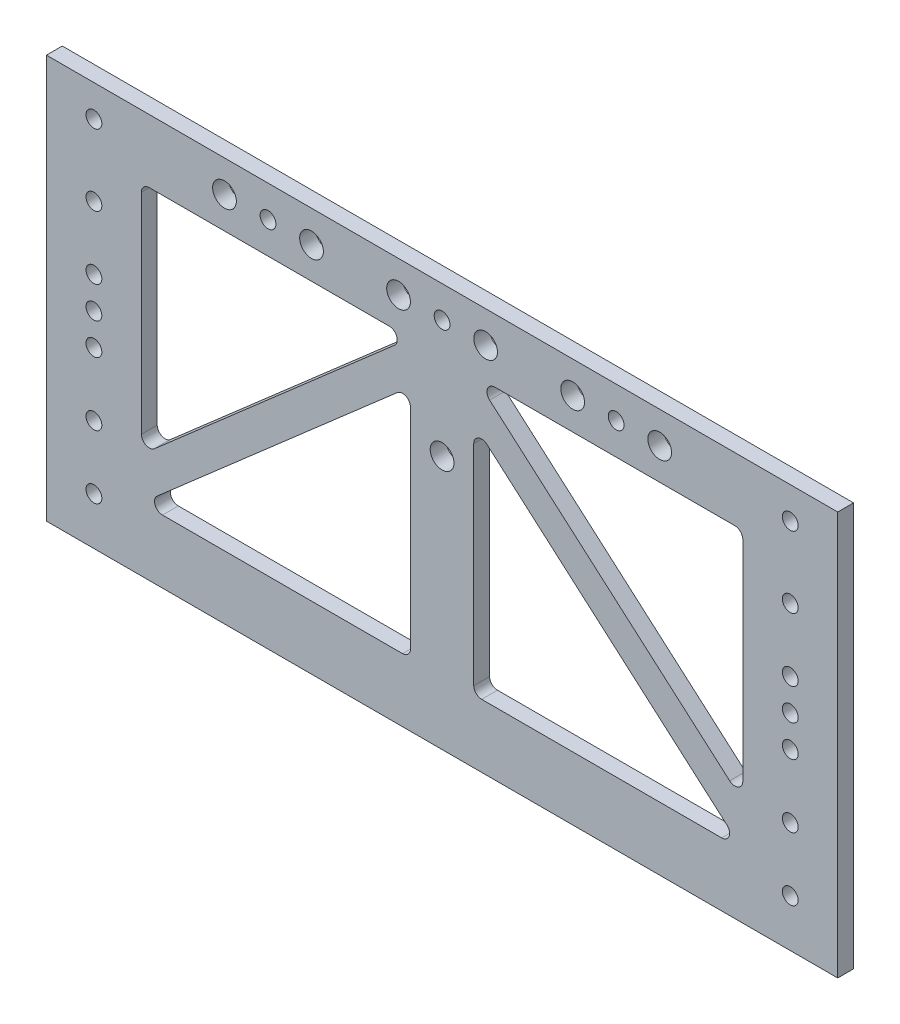
from build123d import *

# Parameters (mm, degrees)
SKETCH1_W                   = 635
SKETCH1_H                   = 323.85
BOSS_EXTRUDE1_DEPTH         = 12.7
F_3_4_0_75_DIAMETER_HOLE1_D = 19.05
F_1_2_0_5_DIAMETER_HOLE1_D  = 12.7
LPATTERN1_COUNT             = 2
LPATTERN1_PITCH             = 558.8
LPATTERN1_COUNT_DIR2        = 5
LPATTERN1_PITCH_DIR2        = 50.8
HOLE1_OUTLINE_R             = 9.525
HOLE1_DEPTH                 = 12.7
LPATTERN2_COUNT             = 6
LPATTERN2_PITCH             = 69.85
HOLE2_OUTLINE_R             = 6.35
HOLE2_DEPTH                 = 12.7
LPATTERN3_COUNT             = 5
LPATTERN3_PITCH             = 139.7
CUT_EXTRUDE1_DEPTH          = 713.927143893
FILLET1_R                   = 6.35
F_1_2_0_5_DIAMETER_HOLE2_D  = 12.7


# Read off the part's stored shape, not the designer's step: Hole1, Hole2
with BuildPart() as part:
    # Sketch1 → Boss-Extrude1 (new body)
    with BuildSketch(Plane.XY):
        with Locations((317.5, 161.925)):
            Rectangle(SKETCH1_W, SKETCH1_H)
    extrude(amount=BOSS_EXTRUDE1_DEPTH)

    # 3/4 (0.75) Diameter Hole1 (through all)
    with Locations(Plane.XY.offset(12.7)):
        with Locations((317.5, 203.85)):
            Hole(F_3_4_0_75_DIAMETER_HOLE1_D / 2)

    # 1/2 (0.5) Diameter Hole1 (through all)
    with Locations(Plane.XY.offset(12.7)):
        with Locations((38.1, 38.1)):
            f_1_2_0_5_diameter_hole1 = Hole(F_1_2_0_5_DIAMETER_HOLE1_D / 2)

    # LPattern1: 1_2 _0.5_ Diameter Hole1 2 × 5
    with Locations(*[(i * LPATTERN1_PITCH, j * LPATTERN1_PITCH_DIR2, 0) for i in range(LPATTERN1_COUNT) for j in range(LPATTERN1_COUNT_DIR2) if (i, j) != (0, 0)]):
        add(f_1_2_0_5_diameter_hole1, mode=Mode.SUBTRACT)

    # Hole1 outline → Hole1 (cut)
    with BuildSketch(Plane.XY):
        with Locations((142.875, 298.45)):
            Circle(HOLE1_OUTLINE_R)
    hole1 = extrude(amount=HOLE1_DEPTH, mode=Mode.SUBTRACT)

    # LPattern2: Hole1 ×6
    with Locations(*[(i * LPATTERN2_PITCH, 0, 0) for i in range(1, LPATTERN2_COUNT)]):
        add(hole1, mode=Mode.SUBTRACT)

    # Hole2 outline → Hole2 (cut)
    with BuildSketch(Plane.XY):
        with Locations((38.1, 298.45)):
            Circle(HOLE2_OUTLINE_R)
    hole2 = extrude(amount=HOLE2_DEPTH, mode=Mode.SUBTRACT)

    # LPattern3: Hole2 ×5
    with Locations(*[(i * LPATTERN3_PITCH, 0, 0) for i in range(1, LPATTERN3_COUNT)]):
        add(hole2, mode=Mode.SUBTRACT)

    # Sketch9 → Cut-Extrude1 (cut, through all)
    with BuildSketch(Plane.XY.offset(12.7)):
        Polygon((76.2, 273.05), (292.1, 273.05), (76.2, 84.521018444), align=None)
        Polygon((76.2, 50.8), (292.1, 239.328981556), (292.1, 50.8), align=None)
        Polygon((342.9, 273.05), (558.8, 273.05), (558.8, 84.521018444), align=None)
        Polygon((342.9, 239.328981556), (342.9, 50.8), (558.8, 50.8), align=None)
    extrude(amount=-CUT_EXTRUDE1_DEPTH, mode=Mode.SUBTRACT)

    # Fillet1
    fillet1_edges = [part.edges().sort_by_distance(p)[0] for p in [
        (292.1, 50.8, 6.35),
        (76.2, 50.8, 6.35),
        (292.1, 239.328981556, 6.35),
        (558.8, 84.521018444, 6.35),
        (342.9, 273.05, 6.35),
        (558.8, 273.05, 6.35),
        (342.9, 239.328981556, 6.35),
        (558.8, 50.8, 6.35),
        (342.9, 50.8, 6.35),
        (76.2, 84.521018444, 6.35),
        (76.2, 273.05, 6.35),
        (292.1, 273.05, 6.35),
    ]]
    fillet(fillet1_edges, radius=FILLET1_R)

    # 1/2 (0.5) Diameter Hole2 (through all)
    with Locations(Plane.XY.offset(12.7)):
        with Locations((38.1, 165.1), (596.9, 165.1)):
            Hole(F_1_2_0_5_DIAMETER_HOLE2_D / 2)


solid = part.part
